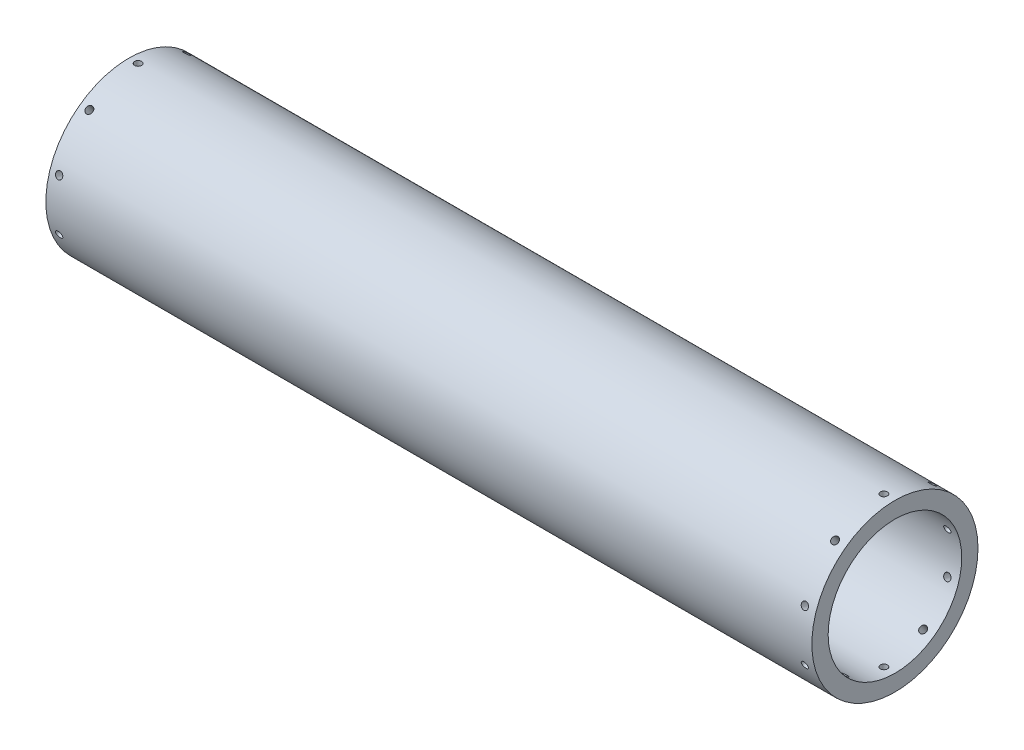
from build123d import *

# Parameters (mm, degrees)
SKETCH1_R           = 57.15
SKETCH1_R_2         = 45.9486
BOSS_EXTRUDE1_DEPTH = 527.05
SKETCH2_R           = 45.9486
SKETCH2_R_2         = 44.577
BOSS_EXTRUDE2_DEPTH = 88.9
SKETCH6_R           = 2.413
CUT_EXTRUDE1_DEPTH  = 15.24
CIRPATTERN1_COUNT   = 10
SKETCH7_R           = 2.413
CUT_EXTRUDE2_DEPTH  = 15.24
CIRPATTERN2_COUNT   = 10


with BuildPart() as part:
    # Sketch1 → Boss-Extrude1 (new body)
    with BuildSketch(Plane(origin=(0, 0, 0), x_dir=(0, 0, -1), z_dir=(1, 0, 0))):
        Circle(SKETCH1_R)
        Circle(SKETCH1_R_2, mode=Mode.SUBTRACT)
    extrude(amount=BOSS_EXTRUDE1_DEPTH)

    # Sketch2 → Boss-Extrude2 (add)
    with BuildSketch(Plane.ZY):
        Circle(SKETCH2_R)
        Circle(SKETCH2_R_2, mode=Mode.SUBTRACT)
    extrude(amount=-BOSS_EXTRUDE2_DEPTH)

    # Sketch6 → Cut-Extrude1 (cut)
    with BuildSketch(Plane(origin=(0, 57.15, 0), x_dir=(1, 0, 0), z_dir=(0, 1, 0))):
        with Locations((6.35, 0)):
            Circle(SKETCH6_R)
    cut_extrude1 = extrude(amount=-CUT_EXTRUDE1_DEPTH, mode=Mode.SUBTRACT)

    # CirPattern1: Cut-Extrude1 ×10 about axis
    cirpattern1_axis = Axis((0, 0, 0), (-1, 0, 0))
    for i in range(1, CIRPATTERN1_COUNT):
        add(cut_extrude1.rotate(cirpattern1_axis, i * 360 / CIRPATTERN1_COUNT), mode=Mode.SUBTRACT)

    # Sketch7 → Cut-Extrude2 (cut)
    with BuildSketch(Plane(origin=(0, 57.15, 0), x_dir=(1, 0, 0), z_dir=(0, 1, 0))):
        with Locations((519.43, 0)):
            Circle(SKETCH7_R)
    cut_extrude2 = extrude(amount=-CUT_EXTRUDE2_DEPTH, mode=Mode.SUBTRACT)

    # CirPattern2: Cut-Extrude2 ×10 about axis
    cirpattern2_axis = Axis((527.05, 0, 0), (1, 0, 0))
    for i in range(1, CIRPATTERN2_COUNT):
        add(cut_extrude2.rotate(cirpattern2_axis, i * 360 / CIRPATTERN2_COUNT), mode=Mode.SUBTRACT)


solid = part.part
